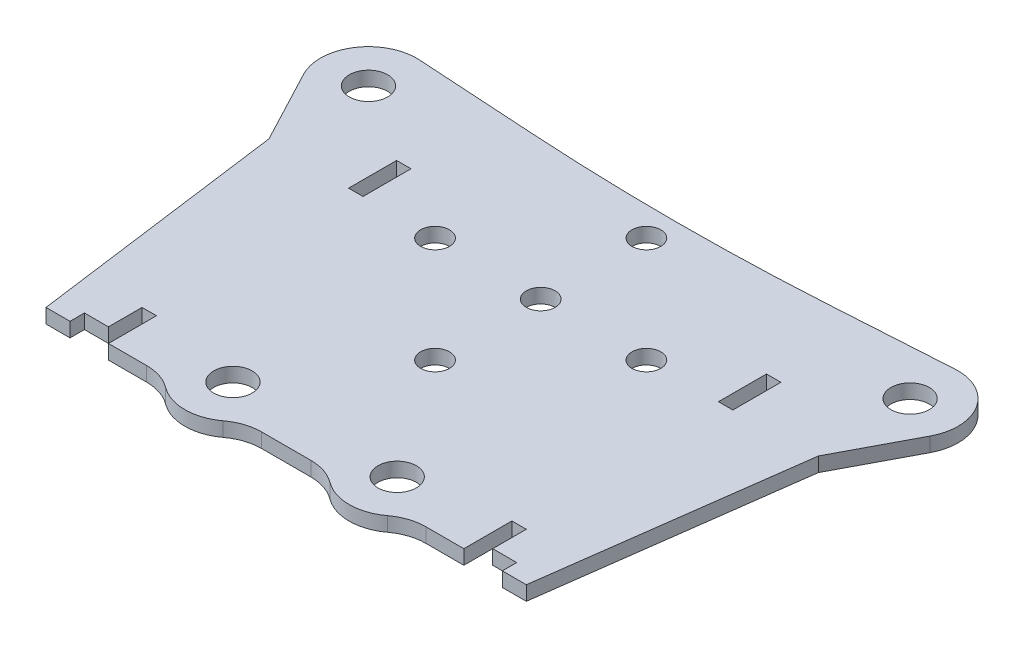
from build123d import *

# Parameters (mm, degrees)
SZKIC1_R                    = 4
SZKIC1_R_2                  = 3
SZKIC1_W                    = 3
SZKIC1_H                    = 10
DODANIE_WYCI_GNI_CIE1_DEPTH = 3


with BuildPart() as part:
    # Szkic1 → Dodanie-wyciągnięcie1 (new body)
    with BuildSketch(Plane(origin=(0, 0, 0), x_dir=(1, 0, 0), z_dir=(0, 1, 0))):
        with BuildLine():
            Line((-50, -53), (-45, -53))
            Line((-45, -53), (-45, -50))
            Line((-45, -50), (-40, -50))
            Line((-40, -50), (-40, -43))
            Line((-40, -43), (-37, -43))
            Line((-37, -43), (-37, -53))
            Line((-37, -53), (-29.080487833, -53))
            ThreePointArc((-29.080487833, -53), (-25.924291135, -53.511142197), (-23.0907475, -54.99231552))
            ThreePointArc((-23.0907475, -54.99231552), (-17.101007166, -56.984631039), (-11.111266833, -54.99231552))
            ThreePointArc((-11.111266833, -54.99231552), (-8.277723198, -53.511142197), (-5.121526499, -53))
            Line((-5.121526499, -53), (5.121526499, -53))
            ThreePointArc((5.121526499, -53), (8.277723198, -53.511142197), (11.111266833, -54.99231552))
            ThreePointArc((11.111266833, -54.99231552), (17.101007166, -56.984631039), (23.0907475, -54.99231552))
            ThreePointArc((23.0907475, -54.99231552), (25.924291135, -53.511142197), (29.080487833, -53))
            Line((29.080487833, -53), (37, -53))
            Line((37, -53), (37, -43))
            Line((37, -43), (40, -43))
            Line((40, -43), (40, -50))
            Line((40, -50), (45, -50))
            Line((45, -50), (45, -53))
            Line((45, -53), (50, -53))
            Line((50, -53), (57.188191962, 0.618107333))
            Line((57.188191962, 0.618107333), (65.226304049, 15.855326688))
            ThreePointArc((65.226304049, 15.855326688), (64.747625519, 25.999246722), (55.641167455, 30.493762082))
            Line((55.641167455, 30.493762082), (30.873882582, 28.961513734))
            ThreePointArc((30.873882582, 28.961513734), (0, 28.007406788), (-30.873882582, 28.961513734))
            Line((-30.873882582, 28.961513734), (-55.641167455, 30.493762082))
            ThreePointArc((-55.641167455, 30.493762082), (-64.747625519, 25.999246722), (-65.226304049, 15.855326688))
            Line((-65.226304049, 15.855326688), (-57.188191962, 0.618107333))
            Line((-57.188191962, 0.618107333), (-50, -53))
        make_face()
        with Locations((56.381557247, 20.5212086)):
            Circle(SZKIC1_R, mode=Mode.SUBTRACT)
        Circle(SZKIC1_R_2, mode=Mode.SUBTRACT)
        with Locations((-56.381557247, 20.5212086)):
            Circle(SZKIC1_R, mode=Mode.SUBTRACT)
        with Locations((-17.101007166, -46.984631039)):
            Circle(SZKIC1_R, mode=Mode.SUBTRACT)
        with Locations((0, 22)):
            Circle(SZKIC1_R_2, mode=Mode.SUBTRACT)
        with Locations((-22, 0)):
            Circle(SZKIC1_R_2, mode=Mode.SUBTRACT)
        with Locations((22, 0)):
            Circle(SZKIC1_R_2, mode=Mode.SUBTRACT)
        with Locations((0, -22)):
            Circle(SZKIC1_R_2, mode=Mode.SUBTRACT)
        with Locations((17.101007166, -46.984631039)):
            Circle(SZKIC1_R, mode=Mode.SUBTRACT)
        with Locations((38.5, 5)):
            Rectangle(SZKIC1_W, SZKIC1_H, mode=Mode.SUBTRACT)
        with Locations((-38.5, 5)):
            Rectangle(SZKIC1_W, SZKIC1_H, mode=Mode.SUBTRACT)
    extrude(amount=DODANIE_WYCI_GNI_CIE1_DEPTH)


solid = part.part
